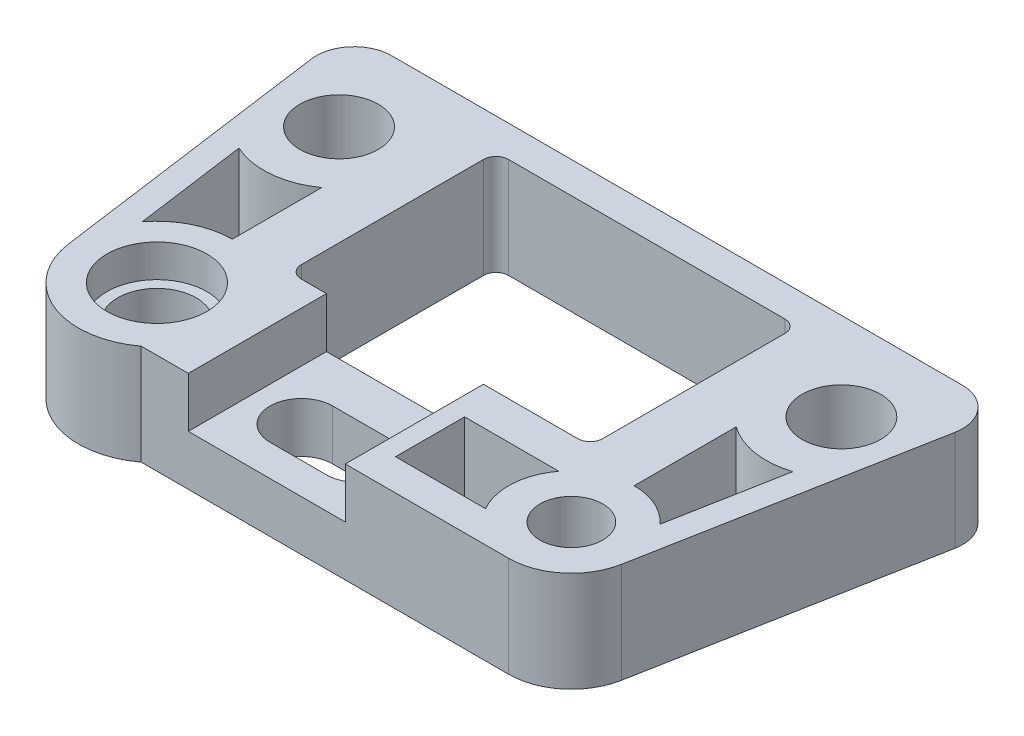
from build123d import *

# Parameters (mm, degrees)
SKETCH3_R           = 3.96875
SKETCH3_R_2         = 3.175
BOSS_EXTRUDE4_DEPTH = 10.16
SKETCH5_W           = 15.875
SKETCH5_H           = 13.97
CUT_EXTRUDE3_DEPTH  = 5.08
FILLET1_R           = 3.81
SKETCH6_R           = 5.05
CUT_EXTRUDE4_DEPTH  = 3.3


with BuildPart() as part:
    # Sketch3 → Boss-Extrude4 (new body)
    with BuildSketch(Plane(origin=(0, 0, 0), x_dir=(1, 0, 0), z_dir=(0, 1, 0))):
        with BuildLine():
            Line((54.2925, 31.75), (-12.3825, 31.75))
            Line((-12.3825, 31.75), (-7.863361559, -1.082336008))
            ThreePointArc((-7.863361559, -1.082336008), (-3.056289676, -7.325503373), (4.7625, -6.35))
            Line((4.7625, -6.35), (41.91, -6.35))
            ThreePointArc((41.91, -6.35), (45.967580476, -4.884520517), (48.152310263, -1.164501002))
            Line((48.152310263, -1.164501002), (54.2925, 31.75))
        make_face()
        Circle(SKETCH3_R, mode=Mode.SUBTRACT)
        with Locations((-4.445, 22.86)):
            Circle(SKETCH3_R, mode=Mode.SUBTRACT)
        with Locations((46.355, 22.86)):
            Circle(SKETCH3_R, mode=Mode.SUBTRACT)
        with Locations((41.91, 0)):
            Circle(SKETCH3_R_2, mode=Mode.SUBTRACT)
        with BuildLine():
            Line((36.195, 8.89), (36.195, 27.305))
            ThreePointArc((36.195, 27.305), (35.823025612, 28.203025612), (34.925, 28.575))
            Line((34.925, 28.575), (6.985, 28.575))
            ThreePointArc((6.985, 28.575), (6.086974388, 28.203025612), (5.715, 27.305))
            Line((5.715, 27.305), (5.715, 8.89))
            ThreePointArc((5.715, 8.89), (6.086974388, 7.991974388), (6.985, 7.62))
            Line((6.985, 7.62), (34.925, 7.62))
            ThreePointArc((34.925, 7.62), (35.823025612, 7.991974388), (36.195, 8.89))
        make_face(mode=Mode.SUBTRACT)
        with BuildLine():
            Line((20.32, 3.175), (14.605, 3.175))
            ThreePointArc((14.605, 3.175), (11.43, 0), (14.605, -3.175))
            Line((14.605, -3.175), (20.32, -3.175))
            ThreePointArc((20.32, -3.175), (22.498043553, -2.310140965), (23.489504023, -0.186733089))
            Line((23.489504023, -0.186733089), (21.228562514, 3.04222602))
            ThreePointArc((21.228562514, 3.04222602), (20.779106407, 3.141631154), (20.32, 3.175))
        make_face(mode=Mode.SUBTRACT)
        with BuildLine():
            Line((46.58698696, 4.295147609), (48.697586564, 15.60902157))
            ThreePointArc((48.697586564, 15.60902157), (45.177345011, 15.331552037), (41.91, 16.670785591))
            Line((41.91, 16.670785591), (41.91, 6.35))
            ThreePointArc((41.91, 6.35), (44.464242812, 5.81363429), (46.58698696, 4.295147609))
        make_face(mode=Mode.SUBTRACT)
        with BuildLine():
            Line((-6.080523252, 4.592563226), (-7.642900683, 15.943510195))
            ThreePointArc((-7.642900683, 15.943510195), (-3.723164456, 15.274266453), (0, 16.670785591))
            Line((0, 16.670785591), (0, 7.62))
            ThreePointArc((0, 7.62), (-3.396252951, 6.82128037), (-6.080523252, 4.592563226))
        make_face(mode=Mode.SUBTRACT)
        with BuildLine():
            Line((36.410738686, -3.175), (27.305, -3.175))
            Line((27.305, -3.175), (27.305, 3.81))
            Line((27.305, 3.81), (36.83, 3.81))
            ThreePointArc((36.83, 3.81), (35.571407985, 0.380461907), (36.410738686, -3.175))
        make_face(mode=Mode.SUBTRACT)
    extrude(amount=BOSS_EXTRUDE4_DEPTH)

    # Sketch5 → Cut-Extrude3 (cut)
    with BuildSketch(Plane(origin=(0, 10.16, 0), x_dir=(1, 0, 0), z_dir=(0, 1, 0))):
        with Locations((17.4625, 0.635)):
            Rectangle(SKETCH5_W, SKETCH5_H)
    extrude(amount=-CUT_EXTRUDE3_DEPTH, mode=Mode.SUBTRACT)

    # Fillet1
    fillet1_edges = [part.edges().sort_by_distance(p)[0] for p in [
        (-12.3825, 5.08, -31.75),
        (54.2925, 5.08, -31.75),
    ]]
    fillet(fillet1_edges, radius=FILLET1_R)

    # Sketch6 → Cut-Extrude4 (cut)
    with BuildSketch(Plane(origin=(0, 10.16, 0), x_dir=(1, 0, 0), z_dir=(0, 1, 0))):
        Circle(SKETCH6_R)
    extrude(amount=-CUT_EXTRUDE4_DEPTH, mode=Mode.SUBTRACT)


solid = part.part
